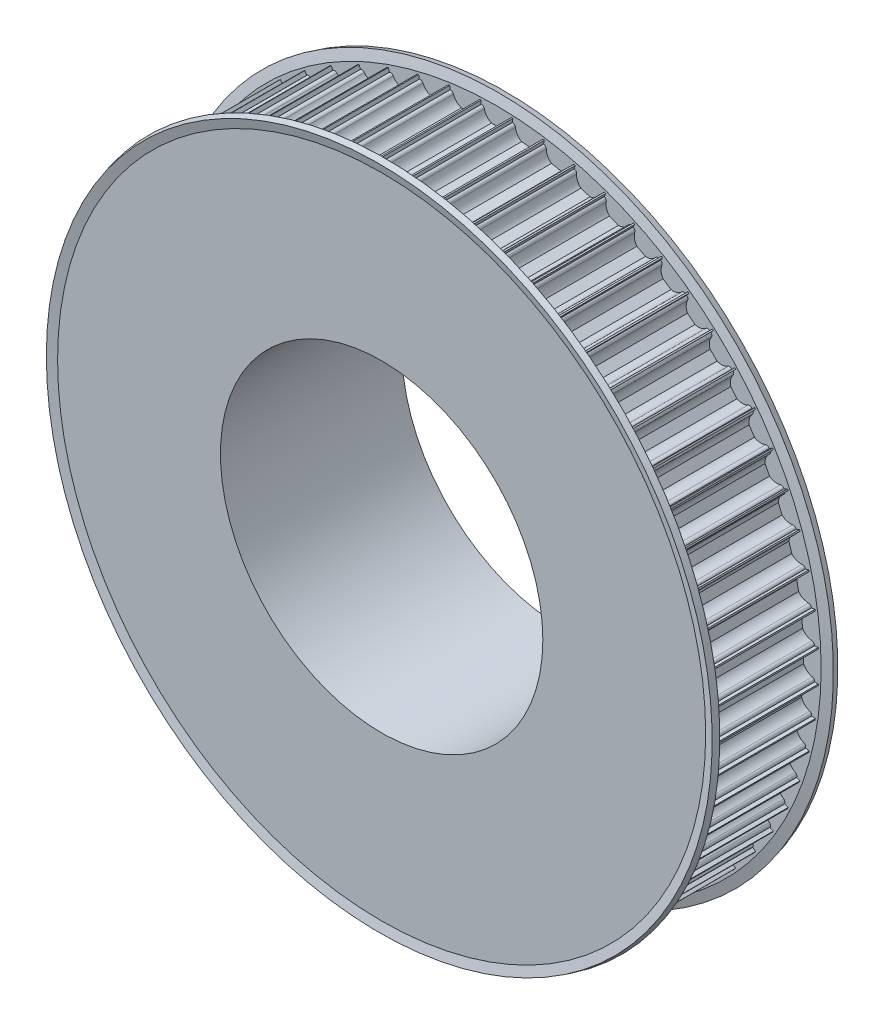
from build123d import *

# Parameters (mm, degrees)
CUT_EXTRUDE1_REACH = 123.758
CIRPATTERN1_COUNT  = 64


with BuildPart() as part:
    # Sketch1 → Revolve1 (revolve)
    with BuildSketch(Plane(origin=(0, 0, 0), x_dir=(0, 0, -1), z_dir=(1, 0, 0))):
        Polygon((0, 40), (45, 40), (45, 55.5), (30, 55.5), (30, 80), (0, 80), align=None)
    revolve(axis=Axis((0, 0, 0), (0, 0, -1)))

    # Sketch2 → Cut-Extrude1 (cut, up to next)
    with BuildSketch(Plane.XY, mode=Mode.PRIVATE) as cut_extrude1_sk1:
        with BuildLine():
            Line((-3.674234614, 79), (-3.75, 79))
            Line((-3.75, 79), (-3.75, 81))
            Line((-3.75, 81), (3.75, 81))
            Line((3.75, 81), (3.75, 79))
            Line((3.75, 79), (3.674234614, 79))
            ThreePointArc((3.674234614, 79), (3.199892965, 78.830947502), (2.939387691, 78.4))
            ThreePointArc((2.939387691, 78.4), (2.331759211, 77.112435701), (1.198957881, 76.25))
            Line((1.198957881, 76.25), (-1.198957881, 76.25))
            ThreePointArc((-1.198957881, 76.25), (-2.331759211, 77.112435701), (-2.939387691, 78.4))
            ThreePointArc((-2.939387691, 78.4), (-3.199892965, 78.830947502), (-3.674234614, 79))
        make_face()
    cut_extrude1_tool1 = extrude(cut_extrude1_sk1.sketch, amount=-CUT_EXTRUDE1_REACH, mode=Mode.PRIVATE) & part.part
    cut_extrude1 = cut_extrude1_tool1.solids().sort_by_distance((0, 78.935169, 0))[0]
    add(cut_extrude1, mode=Mode.SUBTRACT)

    # CirPattern1: Cut-Extrude1 ×64 about axis
    cirpattern1_axis = Axis((0, 0, 0), (0, 0, 1))
    for i in range(1, CIRPATTERN1_COUNT):
        add(cut_extrude1.rotate(cirpattern1_axis, i * 360 / CIRPATTERN1_COUNT), mode=Mode.SUBTRACT)

    # Sketch3 → Revolve2 (revolve)
    with BuildSketch(Plane(origin=(0, 0, 0), x_dir=(0, 0, -1), z_dir=(1, 0, 0))):
        Polygon((30, 55.5), (30, 80.405554958), (30.590163791, 82.608076211), (29.090163791, 83.01), (28.447085729, 80.61), (28.447085729, 55.5), align=None)
        Polygon((1.552914271, 55.5), (0, 55.5), (0, 80.405554958), (-0.590163791, 82.608076211), (0.909836209, 83.01), (1.552914271, 80.61), align=None)
    revolve(axis=Axis((0, 0, 0), (0, 0, 1)))


solid = part.part
